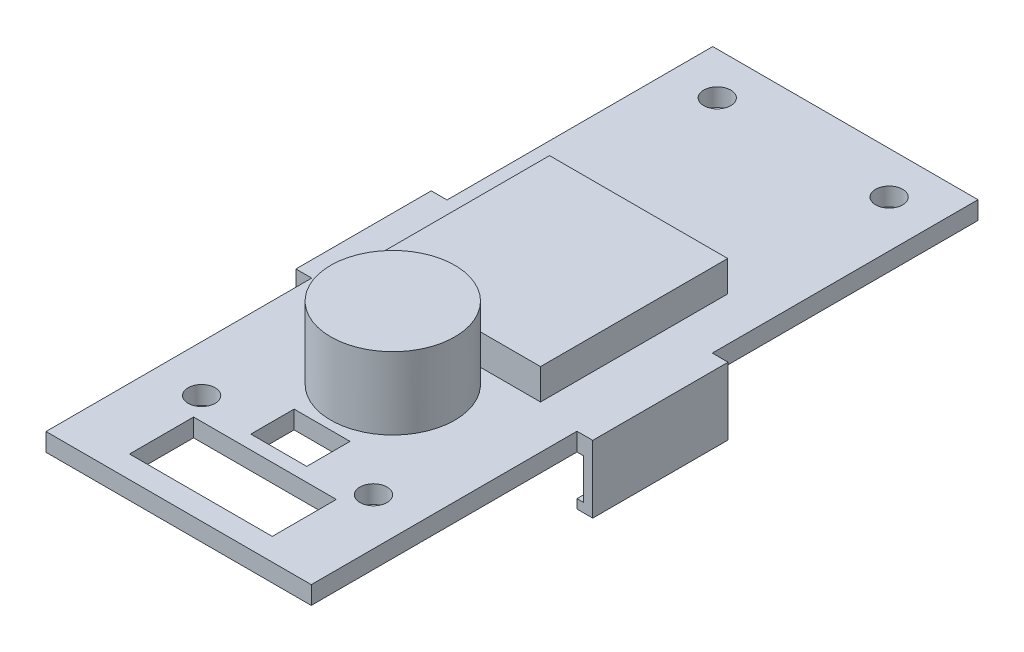
from build123d import *

# Parameters (mm, degrees)
SKETCH1_W               = 29.4
SKETCH1_H               = 73.9
SKETCH1_W_2             = 15.82
SKETCH1_H_2             = 7.1
SKETCH1_W_3             = 6.2
SKETCH1_H_3             = 4.8
BOSS_EXTRUDE1_DEPTH     = 2
SKETCH1_3_R             = 6.875
BOSS_EXTRUDE2_DEPTH     = 10
SHELL1_T                = -0.75
SKETCH1_4_W             = 19.75
SKETCH1_4_H             = 20.75
BOSS_EXTRUDE3_DEPTH     = 5.4
SKETCH2_W               = 19
SKETCH2_H               = 19
CUT_EXTRUDE1_DEPTH      = 4.4
CUT_EXTRUDE2_DEPTH      = 41.563437971
CUT_EXTRUDE2_DEPTH_BACK = 41.563437971
SKETCH5_W               = 15
SKETCH5_H               = 1
SKETCH5_W_2             = 7.5
SKETCH5_H_2             = 2
BOSS_EXTRUDE4_DEPTH     = 0.75
SKETCH6_W               = 15
SKETCH6_H               = 7.47
BOSS_EXTRUDE5_DEPTH     = 1
MIRROR1_START           = -7.5
MIRROR1_DEPTH           = 15


# Read off the part's stored shape, not the designer's step: Mirror1
with BuildPart() as part:
    # Sketch1 → Boss-Extrude1 (new body)
    with BuildSketch(Plane(origin=(0, 0, 0), x_dir=(1, 0, 0), z_dir=(0, 1, 0))):
        Rectangle(SKETCH1_W, SKETCH1_H)
        with Locations((0, -30.932)):
            Rectangle(SKETCH1_W_2, SKETCH1_H_2, mode=Mode.SUBTRACT)
        with Locations((0, -23.449)):
            Rectangle(SKETCH1_W_3, SKETCH1_H_3, mode=Mode.SUBTRACT)
        with BuildLine():
            Line((-9.875, 14.036), (9.875, 14.036))
            Line((9.875, 14.036), (9.875, -6.714))
            Line((9.875, -6.714), (2.239559108, -6.714))
            ThreePointArc((2.239559108, -6.714), (0, -20.089), (-2.239559108, -6.714))
            Line((-2.239559108, -6.714), (-9.875, -6.714))
            Line((-9.875, -6.714), (-9.875, 14.036))
        make_face(mode=Mode.SUBTRACT)
    extrude(amount=BOSS_EXTRUDE1_DEPTH)



with BuildPart() as body_2:
    # Sketch1<3> → Boss-Extrude2 (new body)
    with BuildSketch(Plane(origin=(0, 0, 0), x_dir=(1, 0, 0), z_dir=(0, 1, 0))):
        with Locations(Location((0, -13.214, 0), (0, 0, 270))):
            Circle(SKETCH1_3_R)
    extrude(amount=BOSS_EXTRUDE2_DEPTH)

    # Shell1
    shell1_openings = [body_2.faces().sort_by_distance(p)[0] for p in [
        (0, 0, 13.214),
    ]]
    offset(amount=SHELL1_T, openings=shell1_openings, kind=Kind.INTERSECTION)


with BuildPart() as part_1:
    add(part.part)

    add(body_2.part)  # Boss-Extrude3 merges body 2
    # Sketch1<4> → Boss-Extrude3 (add)
    with BuildSketch(Plane(origin=(0, 0, 0), x_dir=(1, 0, 0), z_dir=(0, 1, 0))):
        with Locations((0, 3.661)):
            Rectangle(SKETCH1_4_W, SKETCH1_4_H)
    extrude(amount=BOSS_EXTRUDE3_DEPTH)

    # Sketch2 → Cut-Extrude1 (cut)
    with BuildSketch(Plane.XZ):
        with Locations((0, -3.661)):
            Rectangle(SKETCH2_W, SKETCH2_H)
    extrude(amount=-CUT_EXTRUDE1_DEPTH, mode=Mode.SUBTRACT)

    # Sketch3 → Cut-Extrude2 (cut, two sides: drawn at the far end of the back side and taken through both)
    with BuildSketch(Plane(origin=(0, 2, 0), x_dir=(1, 0, 0), z_dir=(0, 1, 0)).offset(-CUT_EXTRUDE2_DEPTH_BACK)):
        with BuildLine():
            Line((-9.525, 30.775), (-9.525, 32.275))
            Line((-9.525, 32.275), (-8.025, 32.275))
            ThreePointArc((-8.025, 32.275), (-10.585660172, 33.335660172), (-9.525, 30.775))
        make_face()
        with BuildLine():
            Line((-8.025, 32.275), (-9.525, 32.275))
            Line((-9.525, 32.275), (-9.525, 30.775))
            ThreePointArc((-9.525, 30.775), (-8.464339828, 31.214339828), (-8.025, 32.275))
        make_face()
        with BuildLine():
            ThreePointArc((11.025, 32.275), (9.525, 33.775), (8.025, 32.275))
            Line((8.025, 32.275), (9.525, 32.275))
            Line((9.525, 32.275), (9.525, 30.775))
            ThreePointArc((9.525, 30.775), (10.585660172, 31.214339828), (11.025, 32.275))
        make_face()
        with BuildLine():
            Line((9.525, 32.275), (8.025, 32.275))
            ThreePointArc((8.025, 32.275), (8.464339828, 31.214339828), (9.525, 30.775))
            Line((9.525, 30.775), (9.525, 32.275))
        make_face()
        with BuildLine():
            ThreePointArc((11.025, -24.875), (10.585660172, -23.814339828), (9.525, -23.375))
            Line((9.525, -23.375), (9.525, -24.875))
            Line((9.525, -24.875), (8.025, -24.875))
            ThreePointArc((8.025, -24.875), (9.525, -26.375), (11.025, -24.875))
        make_face()
        with BuildLine():
            Line((9.525, -24.875), (9.525, -23.375))
            ThreePointArc((9.525, -23.375), (8.464339828, -23.814339828), (8.025, -24.875))
            Line((8.025, -24.875), (9.525, -24.875))
        make_face()
        with BuildLine():
            ThreePointArc((-8.025, -24.875), (-8.464339828, -23.814339828), (-9.525, -23.375))
            Line((-9.525, -23.375), (-9.525, -24.875))
            Line((-9.525, -24.875), (-8.025, -24.875))
        make_face()
        with BuildLine():
            Line((-9.525, -24.875), (-9.525, -23.375))
            ThreePointArc((-9.525, -23.375), (-10.585660172, -25.935660172), (-8.025, -24.875))
            Line((-8.025, -24.875), (-9.525, -24.875))
        make_face()
    extrude(amount=CUT_EXTRUDE2_DEPTH + CUT_EXTRUDE2_DEPTH_BACK, mode=Mode.SUBTRACT)

    # Sketch5 → Boss-Extrude4 (add)
    with BuildSketch(Plane(origin=(14.7, 0, 0), x_dir=(0, 0, -1), z_dir=(1, 0, 0))):
        with Locations((0, -4.97)):
            Rectangle(SKETCH5_W, SKETCH5_H)
        with Locations((-3.75, 1)):
            Rectangle(SKETCH5_W_2, SKETCH5_H_2)
        with Locations((3.75, 1)):
            Rectangle(SKETCH5_W_2, SKETCH5_H_2)
    extrude(amount=BOSS_EXTRUDE4_DEPTH)


with BuildPart() as boss_extrude4_piece_1:
    # of the separate pieces the step leaves, piece 1, a body of its own (boss_extrude4_pieces)
    add(part_1.part.solids().sort_by_distance((-14.7, 0, 36.95))[0])



with BuildPart() as boss_extrude4_piece_2:
    # of the separate pieces the step leaves, piece 2, a body of its own (boss_extrude4_pieces)
    add(part_1.part.solids().sort_by_distance((14.7, -4.47, -7.5))[0])


with BuildPart() as boss_extrude4_piece_1_1:
    add(boss_extrude4_piece_1.part)

    add(boss_extrude4_piece_2.part)  # Boss-Extrude5 merges Boss-Extrude4 piece 2
    # Sketch6 → Boss-Extrude5 (add)
    with BuildSketch(Plane(origin=(15.45, 0, 0), x_dir=(0, 0, -1), z_dir=(1, 0, 0))):
        with Locations((0, -1.735)):
            Rectangle(SKETCH6_W, SKETCH6_H)
    extrude(amount=BOSS_EXTRUDE5_DEPTH)

    # Mirror1 outline → Mirror1 (add)
    with BuildSketch(Plane.XY.offset(MIRROR1_START)):
        Polygon((-16.45, 2), (-16.45, -5.47), (-15.45, -5.47), (-15.45, 0), (-14.7, 0), (-14.7, 2), align=None)
    extrude(amount=MIRROR1_DEPTH)


solid = boss_extrude4_piece_1_1.part
